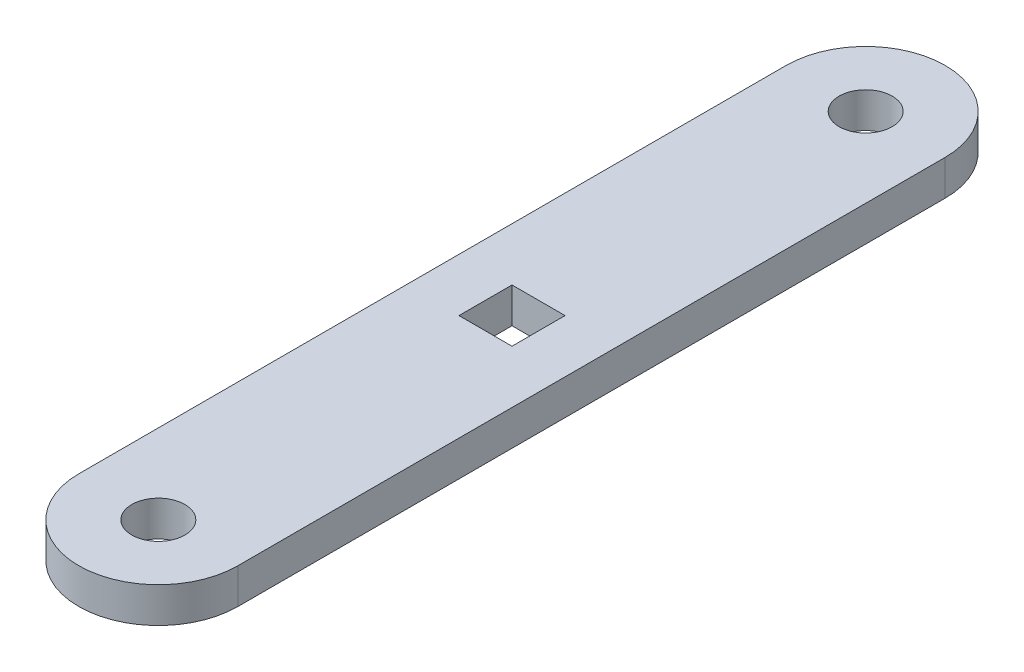
from build123d import *

# Parameters (mm, degrees)
BOSS_EXTRUDE1_DEPTH = 100
SKETCH3_R           = 75
CUT_EXTRUDE2_DEPTH  = 250
SKETCH2_R           = 75
CUT_EXTRUDE4_DEPTH  = 1250.49989996
SKETCH4_W           = 150
SKETCH4_H           = 150
CUT_EXTRUDE5_DEPTH  = 1250.49989996


with BuildPart() as part:
    # Sketch1 → Boss-Extrude1 (new body)
    with BuildSketch(Plane(origin=(0, 0, 0), x_dir=(1, 0, 0), z_dir=(0, 1, 0))):
        with BuildLine():
            Line((-225, 1000), (-225, -1000))
            ThreePointArc((-225, -1000), (0, -1225), (225, -1000))
            Line((225, -1000), (225, 1000))
            ThreePointArc((225, 1000), (0, 1225), (-225, 1000))
        make_face()
    extrude(amount=BOSS_EXTRUDE1_DEPTH)

    # Sketch3 → Cut-Extrude2 (cut)
    with BuildSketch(Plane(origin=(0, 100, 0), x_dir=(1, 0, 0), z_dir=(0, 1, 0))):
        with Locations((0, 1000)):
            Circle(SKETCH3_R)
    extrude(amount=-CUT_EXTRUDE2_DEPTH, mode=Mode.SUBTRACT)

    # Sketch2 → Cut-Extrude4 (cut, through all)
    with BuildSketch(Plane(origin=(0, 100, 0), x_dir=(1, 0, 0), z_dir=(0, 1, 0))):
        with Locations((0, -1000)):
            Circle(SKETCH2_R)
    extrude(amount=-CUT_EXTRUDE4_DEPTH, mode=Mode.SUBTRACT)

    # Sketch4 → Cut-Extrude5 (cut, through all)
    with BuildSketch(Plane(origin=(0, 100, 0), x_dir=(1, 0, 0), z_dir=(0, 1, 0))):
        Rectangle(SKETCH4_W, SKETCH4_H)
    extrude(amount=-CUT_EXTRUDE5_DEPTH, mode=Mode.SUBTRACT)


solid = part.part
